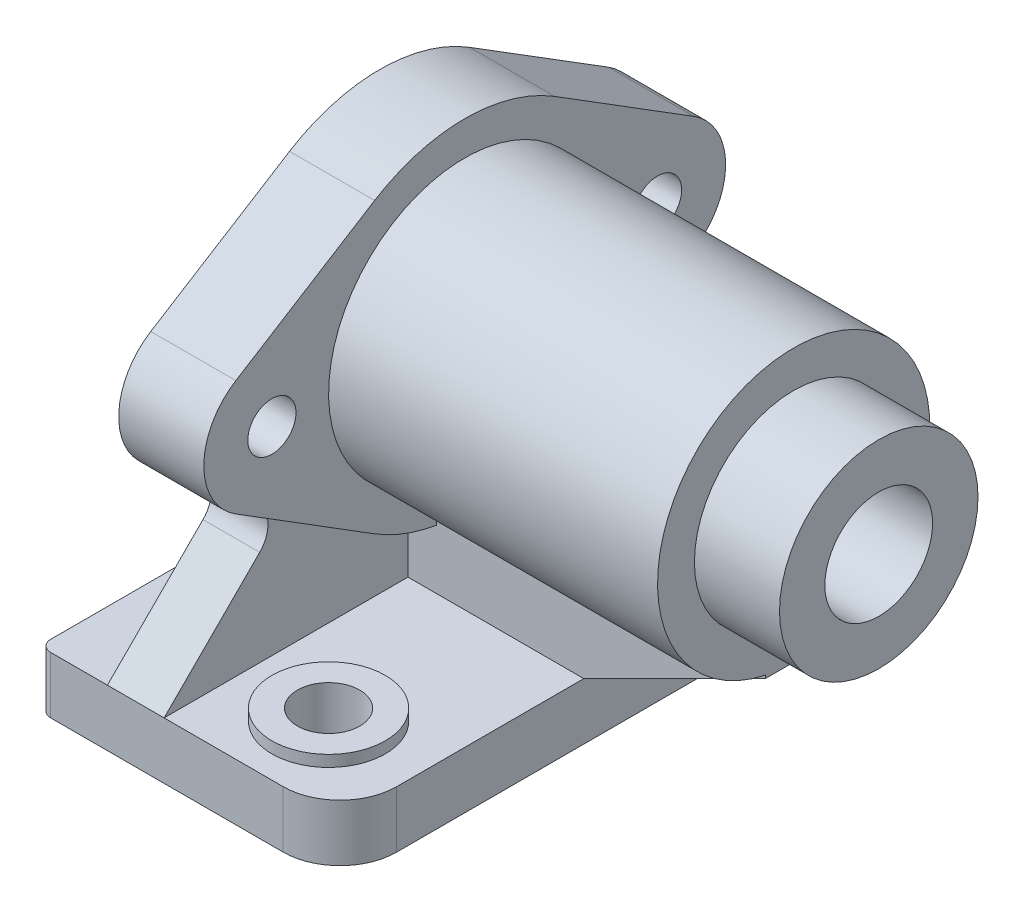
from build123d import *
from OCP.BRepFilletAPI import BRepFilletAPI_MakeFillet

# Parameters (mm, degrees)
EXTRUDE_1_DEPTH      = 15
EXTRUDE_START        = 2
SKETCH_2_R           = 24
EXTRUDE_2_DEPTH      = 75
EXTRUDE_START_2      = -75
SKETCH_3_R           = 17.5
EXTRUDE_3_DEPTH      = 90
SKETCH_4_W           = 53
SKETCH_4_H           = 96
EXTRUDE_4_DEPTH      = 10
FILLET_1_R1          = 2
FILLET_1_R2          = 10
SKETCH_5_R           = 10
EXTRUDE_5_DEPTH      = 2
SKETCH_6_R           = 5.5
CUT_EXTRUDE_1_DEPTH  = 122.128031438
EXTRUDE_6_DEPTH      = 10
RIB_1_REACH          = 114.018
SKETCH_8_WALL_W      = 244.903673704
SKETCH_8_WALL_H      = 10
SKETCH_12_R          = 21
CUT_EXTRUDE_3_DEPTH  = 12
SKETCH_13_R          = 18
CUT_EXTRUDE_4_DEPTH  = 56
HOLE_WIZARD_G1_2_1_D = 19
HOLE_WIZARD_M10_1_D  = 8.5
RIB_START            = -5
RIB_13_DEPTH         = 10


with BuildPart() as part:
    # 草图1 → 凸台-拉伸1 (new body)
    with BuildSketch(Plane(origin=(0, 0, 0), x_dir=(0, 0, -1), z_dir=(1, 0, 0))):
        with BuildLine():
            Line((15.882352941, 25.45095018), (40.352941176, 10.180380072))
            ThreePointArc((40.352941176, 10.180380072), (46, 0), (40.352941176, -10.180380072))
            Line((40.352941176, -10.180380072), (15.882352941, -25.45095018))
            ThreePointArc((15.882352941, -25.45095018), (0, -30), (-15.882352941, -25.45095018))
            Line((-15.882352941, -25.45095018), (-40.352941176, -10.180380072))
            ThreePointArc((-40.352941176, -10.180380072), (-46, 0), (-40.352941176, 10.180380072))
            Line((-40.352941176, 10.180380072), (-15.882352941, 25.45095018))
            ThreePointArc((-15.882352941, 25.45095018), (0, 30), (15.882352941, 25.45095018))
        make_face()
    extrude(amount=EXTRUDE_1_DEPTH)

    # 草图2 → 凸台-拉伸2 (add)
    with BuildSketch(Plane.ZY.offset(EXTRUDE_START)):
        Circle(SKETCH_2_R)
    extrude(amount=-EXTRUDE_2_DEPTH)

    # 草图3 → 凸台-拉伸3 (add)
    with BuildSketch(Plane(origin=(73, 0, 0), x_dir=(0, 0, -1), z_dir=(1, 0, 0)).offset(EXTRUDE_START_2)):
        with Locations(Location((0, 0, 0), (0, 0, 180))):
            Circle(SKETCH_3_R)
    extrude(amount=EXTRUDE_3_DEPTH)



with BuildPart() as body_2:
    # 草图4 → 凸台-拉伸4 (new body)
    with BuildSketch(Plane(origin=(0, -50, 0), x_dir=(1, 0, 0), z_dir=(0, 1, 0))):
        with Locations((14.5, 0)):
            Rectangle(SKETCH_4_W, SKETCH_4_H)
    extrude(amount=EXTRUDE_4_DEPTH)

    # 圆角1: one fillet with a radius per group of edges: ONE call of the kernel's fillet builder (fillet() takes one radius for all edges)
    fillet_1_edges_1 = [body_2.edges().sort_by_distance(p)[0] for p in [
        (-12, -45, 48),
        (-12, -45, -48),
    ]]
    fillet_1_edges_2 = [body_2.edges().sort_by_distance(p)[0] for p in [
        (41, -45, -48),
        (41, -45, 48),
    ]]
    fillet_1 = BRepFilletAPI_MakeFillet(body_2.part.solid().wrapped)
    for e in fillet_1_edges_1:
        fillet_1.Add(FILLET_1_R1, e.wrapped)
    for e in fillet_1_edges_2:
        fillet_1.Add(FILLET_1_R2, e.wrapped)
    add(Compound.cast(fillet_1.Shape()), mode=Mode.REPLACE)

    # 草图5 → 凸台-拉伸5 (add)
    with BuildSketch(Plane(origin=(0, -40, 0), x_dir=(1, 0, 0), z_dir=(0, 1, 0))):
        with Locations(Location((25, 34, 0), (0, 0, 90))):
            Circle(SKETCH_5_R)
    extrude_5 = extrude(amount=EXTRUDE_5_DEPTH)

    # 草图6 → 切除-拉伸1 (cut, through all)
    with BuildSketch(Plane(origin=(0, -38, 0), x_dir=(1, 0, 0), z_dir=(0, 1, 0))):
        with Locations(Location((25, 34, 0), (0, 0, 270))):
            Circle(SKETCH_6_R)
    cut_extrude_1 = extrude(amount=-CUT_EXTRUDE_1_DEPTH, mode=Mode.SUBTRACT)

    # 镜向1: 凸台-拉伸5, 切除-拉伸1 across plane
    add(extrude_5.mirror(Plane.XY))
    add(cut_extrude_1.mirror(Plane.XY), mode=Mode.SUBTRACT)


with BuildPart() as part_1:
    add(part.part)

    add(body_2.part)  # 凸台-拉伸6 merges body 2
    # 草图7 → 凸台-拉伸6 (add)
    with BuildSketch(Plane.ZY):
        with BuildLine():
            Line((48, -40), (31.147709092, -23.147709092))
            ThreePointArc((31.147709092, -23.147709092), (29.715553271, -19.044672956), (32.036184174, -15.370350156))
            Line((32.036184174, -15.370350156), (15.882352941, -25.45095018))
            ThreePointArc((15.882352941, -25.45095018), (0, -30), (-15.882352941, -25.45095018))
            Line((-15.882352941, -25.45095018), (-32.036184174, -15.370350156))
            ThreePointArc((-32.036184174, -15.370350156), (-29.715553271, -19.044672956), (-31.147709092, -23.147709092))
            Line((-31.147709092, -23.147709092), (-48, -40))
            Line((-48, -40), (-46, -40))
            Line((-46, -40), (46, -40))
            Line((46, -40), (48, -40))
        make_face()
    extrude(amount=-EXTRUDE_6_DEPTH)

    # 草图8 wall → 筋1 (add, up to next)
    with BuildSketch(Plane(origin=(-7, -32, 0), x_dir=(0.529998940003, 0.847998304005, 0), z_dir=(-0.847998304005, 0.529998940003, 0)), mode=Mode.PRIVATE) as rib_1_sk1:
        Rectangle(SKETCH_8_WALL_W, SKETCH_8_WALL_H)
    rib_1_tool1 = extrude(rib_1_sk1.sketch, amount=-RIB_1_REACH, mode=Mode.PRIVATE) - part_1.part
    add(rib_1_tool1.solids().sort_by_distance((-7, -32, 0))[0])

    # 草图12 → 切除-拉伸3 (cut)
    with BuildSketch(Plane.ZY.offset(2)):
        Circle(SKETCH_12_R)
    extrude(amount=-CUT_EXTRUDE_3_DEPTH, mode=Mode.SUBTRACT)

    # 草图13 → 切除-拉伸4 (cut)
    with BuildSketch(Plane.ZY.offset(-10)):
        Circle(SKETCH_13_R)
    extrude(amount=-CUT_EXTRUDE_4_DEPTH, mode=Mode.SUBTRACT)

    # G1/2 螺纹孔1 (through all)
    with Locations(Plane.ZY.offset(-66)):
        with Locations((0, 0)):
            Hole(HOLE_WIZARD_G1_2_1_D / 2)

    # M10 螺纹孔1 (through all)
    with Locations(Plane.ZY):
        with Locations((34, 0), (-34, 0)):
            Hole(HOLE_WIZARD_M10_1_D / 2)

    # 筋13: read off the stored shape, not the designer's step
    # 筋13 outline → 筋13 (add)
    with BuildSketch(Plane.XY.offset(RIB_START)):
        Polygon((41, -40), (73, -24.001), (73, -23.473389189), (15, -23.473389189), (15, -29.580398915), (10, -29.580398915), (10, -40), align=None)
    extrude(amount=RIB_13_DEPTH)


solid = part_1.part
